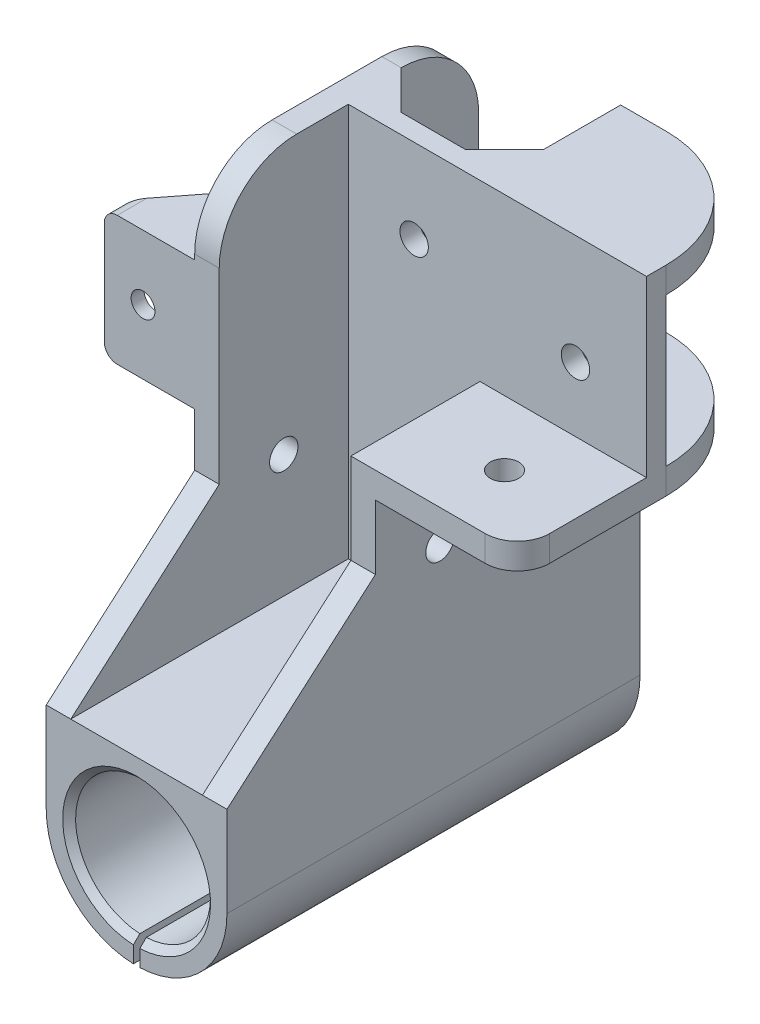
from build123d import *

# Parameters (mm, degrees)
BOSS_EXTRUDE1_DEPTH     = 64
CUT_EXTRUDE1_DEPTH      = 61
CUT_EXTRUDE2_DEPTH      = 103.493902258
CUT_EXTRUDE2_DEPTH_BACK = 103.493902258
CUT_EXTRUDE3_DEPTH      = 43
CUT_EXTRUDE4_DEPTH      = 105.961897849
CHAMFER1_SIZE           = 1
SKETCH6_R               = 2.2
CUT_EXTRUDE5_DEPTH      = 94.648278148
BOSS_EXTRUDE2_DEPTH     = 14
CUT_EXTRUDE6_DEPTH      = 106.81625079
SKETCH9_R               = 1.85
CUT_EXTRUDE7_DEPTH      = 93.746967605
FILLET1_R               = 2
FILLET2_R               = 12
SKETCH10_R              = 2.2
CUT_EXTRUDE8_DEPTH      = 108.168092266
FILLET3_R               = 5
FILLET4_START           = 44
FILLET4_DEPTH           = 31
SKETCH11_R              = 2.2
CUT_EXTRUDE9_DEPTH      = 97.098348533
SKETCH12_W              = 18
SKETCH12_H              = 23
CUT_EXTRUDE10_DEPTH     = 22


with BuildPart() as part:
    # Sketch1 → Boss-Extrude1 (new body)
    with BuildSketch(Plane.XY):
        with BuildLine():
            Line((-14, 0), (-14, 75))
            Line((-14, 75), (36, 75))
            Line((36, 75), (36, 44))
            Line((36, 44), (14, 44))
            Line((14, 44), (14, 0))
            ThreePointArc((14, 0), (0, -14), (-14, 0))
        make_face()
    extrude(amount=BOSS_EXTRUDE1_DEPTH)

    # Sketch2 → Cut-Extrude1 (cut)
    with BuildSketch(Plane(origin=(0, 75, 0), x_dir=(1, 0, 0), z_dir=(0, 1, 0))):
        Polygon((-11, 0), (-11, -12), (-5, -18), (5, -18), (11, -12), (11, 0), align=None)
    extrude(amount=-CUT_EXTRUDE1_DEPTH, mode=Mode.SUBTRACT)

    # Sketch3 → Cut-Extrude2 (cut, two sides: drawn at the far end of the back side and taken through both)
    with BuildSketch(Plane(origin=(14, 0, 0), x_dir=(0, 0, -1), z_dir=(1, 0, 0)).offset(-CUT_EXTRUDE2_DEPTH_BACK)):
        Polygon((-64, 14), (-41, 34), (-41, 75), (-64, 75), align=None)
    extrude(amount=CUT_EXTRUDE2_DEPTH + CUT_EXTRUDE2_DEPTH_BACK, mode=Mode.SUBTRACT)

    # Sketch4 → Cut-Extrude3 (cut)
    with BuildSketch(Plane.XY.offset(64)):
        Polygon((-10.2, 14), (-10.2, 75), (36, 75), (36, 48), (10.2, 48), (10.2, 14), align=None)
    extrude(amount=-CUT_EXTRUDE3_DEPTH, mode=Mode.SUBTRACT)

    # Sketch5 → Cut-Extrude4 (cut, through all)
    with BuildSketch(Plane.XY.offset(64)):
        with BuildLine():
            Line((-0.5, -10.438031424), (-0.5, -13.99106858))
            ThreePointArc((-0.5, -13.99106858), (0, -14), (0.5, -13.99106858))
            Line((0.5, -13.99106858), (0.5, -10.438031424))
            ThreePointArc((0.5, -10.438031424), (0, 10.45), (-0.5, -10.438031424))
        make_face()
    extrude(amount=-CUT_EXTRUDE4_DEPTH, mode=Mode.SUBTRACT)

    # Chamfer1
    chamfer1_edges = [part.edges().sort_by_distance(p)[0] for p in [
        (0, 10.45, 0),
        (0, 10.45, 64),
    ]]
    chamfer(chamfer1_edges, length=CHAMFER1_SIZE)

    # Sketch6 → Cut-Extrude5 (cut, through all)
    with BuildSketch(Plane.XY.offset(21)):
        with Locations((0, 62)):
            Circle(SKETCH6_R)
        with Locations((0, 27)):
            Circle(SKETCH6_R)
        with Locations((25, 58)):
            Circle(SKETCH6_R)
    extrude(amount=-CUT_EXTRUDE5_DEPTH, mode=Mode.SUBTRACT)

    # Sketch7 → Boss-Extrude2 (add)
    with BuildSketch(Plane(origin=(-14, 0, 0), x_dir=(0, 0, -1), z_dir=(1, 0, 0))):
        Polygon((-41, 62.2), (-21, 62.2), (-21, 60.2), (-39, 60.2), (-39, 44.2), (-21, 44.2), (-21, 42.2), (-41, 42.2), align=None)
    extrude(amount=-BOSS_EXTRUDE2_DEPTH)

    # Sketch8 → Cut-Extrude6 (cut, through all)
    with BuildSketch(Plane(origin=(0, 62.2, 0), x_dir=(1, 0, 0), z_dir=(0, 1, 0))):
        Polygon((-14, -21), (-28, -39), (-28, -21), align=None)
    extrude(amount=-CUT_EXTRUDE6_DEPTH, mode=Mode.SUBTRACT)

    # Sketch9 → Cut-Extrude7 (cut, through all)
    with BuildSketch(Plane.XY.offset(41)):
        with Locations((-22, 52.2)):
            Circle(SKETCH9_R)
    extrude(amount=-CUT_EXTRUDE7_DEPTH, mode=Mode.SUBTRACT)

    # Fillet1
    fillet1_edges = [part.edges().sort_by_distance(p)[0] for p in [
        (-28, 42.2, 40),
        (-28, 62.2, 40),
    ]]
    fillet(fillet1_edges, radius=FILLET1_R)

    # Fillet2
    fillet2_edges = [part.edges().sort_by_distance(p)[0] for p in [
        (-12.1, 75, 41),
        (-12.5, 75, 0),
    ]]
    fillet(fillet2_edges, radius=FILLET2_R)

    # Sketch10 → Cut-Extrude8 (cut, through all)
    with BuildSketch(Plane(origin=(14, 0, 0), x_dir=(0, 0, -1), z_dir=(1, 0, 0))):
        with Locations(Location((-31, 33, 0), (0, 0, 90))):
            Circle(SKETCH10_R)
    extrude(amount=-CUT_EXTRUDE8_DEPTH, mode=Mode.SUBTRACT)

    # Fillet3
    fillet3_edges = [part.edges().sort_by_distance(p)[0] for p in [
        (36, 46, 41),
    ]]
    fillet(fillet3_edges, radius=FILLET3_R)

    # Fillet4: read off the stored shape, not the designer's step
    # Fillet4 outline → Fillet4 (cut)
    with BuildSketch(Plane(origin=(0, 0, 0), x_dir=(1, 0, 0), z_dir=(0, 1, 0)).offset(FILLET4_START)):
        with BuildLine():
            ThreePointArc((18, 0), (30.727922061, -5.272077939), (36, -18))
            Line((36, -18), (36, 0))
            Line((36, 0), (18, 0))
        make_face()
    extrude(amount=FILLET4_DEPTH, mode=Mode.SUBTRACT)

    # Sketch11 → Cut-Extrude9 (cut, through all)
    with BuildSketch(Plane(origin=(0, 48, 0), x_dir=(1, 0, 0), z_dir=(0, 1, 0))):
        with Locations(Location((24, -31, 0), (0, 0, 270))):
            Circle(SKETCH11_R)
    extrude(amount=-CUT_EXTRUDE9_DEPTH, mode=Mode.SUBTRACT)

    # Sketch12 → Cut-Extrude10 (cut)
    with BuildSketch(Plane.ZY.offset(-36)):
        with Locations((9, 59.5)):
            Rectangle(SKETCH12_W, SKETCH12_H)
    extrude(amount=CUT_EXTRUDE10_DEPTH, mode=Mode.SUBTRACT)


solid = part.part
